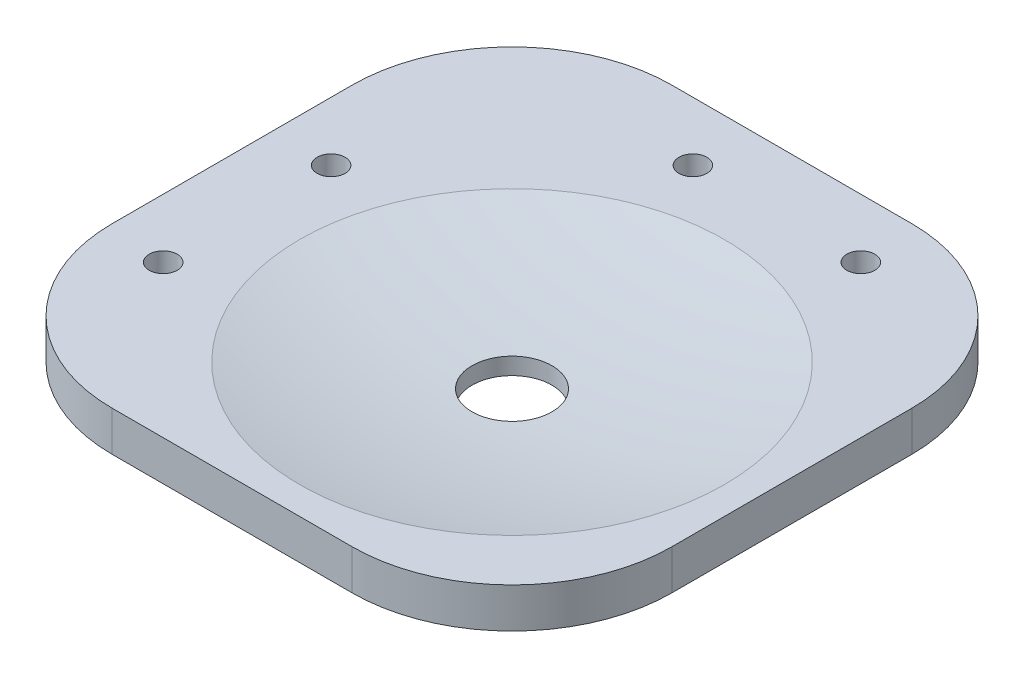
from build123d import *

# Parameters (mm, degrees)
SKETCH1_W           = 60
SKETCH1_H           = 60
BOSS_EXTRUDE1_DEPTH = 5
SKETCH2_R           = 5
CUT_EXTRUDE1_DEPTH  = 43.720018727
BOSS_EXTRUDE2_DEPTH = 5
SKETCH4_R           = 1.75
CUT_EXTRUDE2_DEPTH  = 57.789083467
FILLET1_R           = 20


with BuildPart() as part:
    # Sketch1 → Boss-Extrude1 (new body)
    with BuildSketch(Plane(origin=(0, 0, 0), x_dir=(1, 0, 0), z_dir=(0, 1, 0))):
        Rectangle(SKETCH1_W, SKETCH1_H)
    extrude(amount=BOSS_EXTRUDE1_DEPTH)

    # Sketch2 → Cut-Extrude1 (cut, through all)
    with BuildSketch(Plane(origin=(0, 5, 0), x_dir=(1, 0, 0), z_dir=(0, 1, 0))):
        Circle(SKETCH2_R)
    extrude(amount=-CUT_EXTRUDE1_DEPTH, mode=Mode.SUBTRACT)

    # Sketch3 → Cut-Revolve1 (revolve, cut)
    with BuildSketch(Plane.XY):
        with BuildLine():
            Line((0, 2.007275927), (0, 240.687318419))
            ThreePointArc((0, 240.687318419), (119.340021246, 121.347297173), (0, 2.007275927))
        make_face()
    revolve(axis=Axis((0, 2.007275927, 0), (0, 1, 0)), mode=Mode.SUBTRACT)

    # Sketch5 → Boss-Extrude2 (add)
    with BuildSketch(Plane(origin=(0, 0, 0), x_dir=(1, 0, 0), z_dir=(0, 1, 0))):
        Polygon((-30, -30), (-40, -30), (-40, 40), (30, 40), (30, 30), (-30, 30), align=None)
    extrude(amount=BOSS_EXTRUDE2_DEPTH)

    # Sketch4 → Cut-Extrude2 (cut, through all)
    with BuildSketch(Plane(origin=(0, 5, 0), x_dir=(1, 0, 0), z_dir=(0, 1, 0))):
        with Locations((-32.627416998, 10)):
            Circle(SKETCH4_R)
        with Locations((-10, 32.627416998)):
            Circle(SKETCH4_R)
        with Locations((11, 32.627416998)):
            Circle(SKETCH4_R)
        with Locations((-32.627416998, -11)):
            Circle(SKETCH4_R)
    extrude(amount=-CUT_EXTRUDE2_DEPTH, mode=Mode.SUBTRACT)

    # Fillet1
    fillet1_edges = [part.edges().sort_by_distance(p)[0] for p in [
        (30, 2.5, 30),
        (30, 2.5, -40),
        (-40, 2.5, -40),
        (-40, 2.5, 30),
    ]]
    fillet(fillet1_edges, radius=FILLET1_R)


solid = part.part
